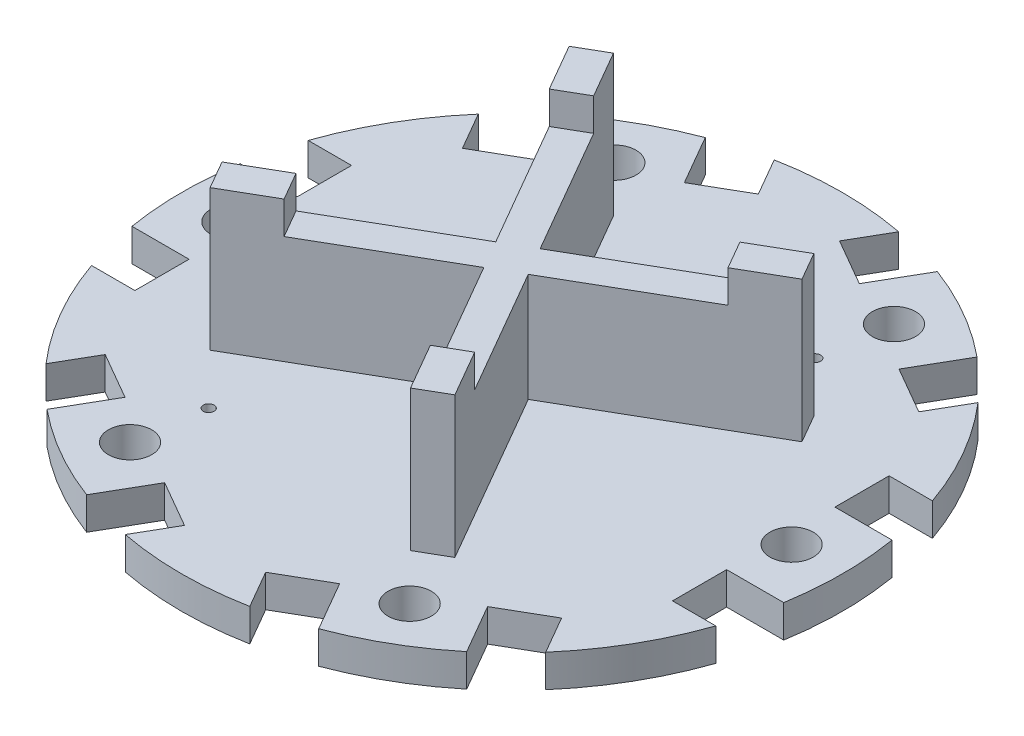
from build123d import *

# Parameters (mm, degrees)
CROQUIS1_R              = 30.5
SALIENTE_EXTRUIR1_DEPTH = 3
CORTAR_EXTRUIR3_START   = -4
CORTAR_EXTRUIR3_DEPTH   = 4
CROQUIS7_R              = 2
CORTAR_EXTRUIR4_DEPTH   = 10
CROQUIS8_R              = 0.5
CORTAR_EXTRUIR5_DEPTH   = 3
SALIENTE_EXTRUIR2_DEPTH = 10
SALIENTE_EXTRUIR3_DEPTH = 3


with BuildPart() as part:
    # Croquis1 → Saliente-Extruir1 (new body)
    with BuildSketch(Plane(origin=(0, 0, 0), x_dir=(1, 0, 0), z_dir=(0, 1, 0))):
        Circle(CROQUIS1_R)
    extrude(amount=SALIENTE_EXTRUIR1_DEPTH)

    # Croquis5 → Cortar-Extruir3 (cut)
    with BuildSketch(Plane(origin=(0, 3, 0), x_dir=(1, 0, 0), z_dir=(0, 1, 0)).offset(CORTAR_EXTRUIR3_START)):
        with BuildLine():
            Line((30.087372767, -5), (24.814059068, -5))
            Line((24.814059068, -5), (24.814059068, -10))
            Line((24.814059068, -10), (28.814059068, -10))
            ThreePointArc((28.814059068, -10), (29.556634924, -7.526973624), (30.087372767, -5))
        make_face()
        with BuildLine():
            ThreePointArc((19.373813402, -23.556429149), (21.296867835, -21.833309883), (23.067283572, -19.953707139))
            Line((23.067283572, -19.953707139), (21.067283572, -16.489605524))
            Line((21.067283572, -16.489605524), (16.737156553, -18.989605524))
            Line((16.737156553, -18.989605524), (19.373813402, -23.556429149))
        make_face()
        with BuildLine():
            Line((24.814059068, 5), (30.087372767, 5))
            ThreePointArc((30.087372767, 5), (29.556634924, 7.526973624), (28.814059068, 10))
            Line((28.814059068, 10), (24.814059068, 10))
            Line((24.814059068, 10), (24.814059068, 5))
        make_face()
        with BuildLine():
            ThreePointArc((5.746775496, -29.953707139), (8.25976709, -29.360283507), (10.713559364, -28.556429149))
            Line((10.713559364, -28.556429149), (8.076902515, -23.989605524))
            Line((8.076902515, -23.989605524), (3.746775496, -26.489605524))
            Line((3.746775496, -26.489605524), (5.746775496, -29.953707139))
        make_face()
        with BuildLine():
            Line((21.067283572, 16.489605524), (23.067283572, 19.953707139))
            ThreePointArc((23.067283572, 19.953707139), (21.296867835, 21.833309883), (19.373813402, 23.556429149))
            Line((19.373813402, 23.556429149), (16.737156553, 18.989605524))
            Line((16.737156553, 18.989605524), (21.067283572, 16.489605524))
        make_face()
        with BuildLine():
            ThreePointArc((-10.713559364, -28.556429149), (-8.25976709, -29.360283507), (-5.746775496, -29.953707139))
            Line((-5.746775496, -29.953707139), (-3.746775496, -26.489605524))
            Line((-3.746775496, -26.489605524), (-8.076902515, -23.989605524))
            Line((-8.076902515, -23.989605524), (-10.713559364, -28.556429149))
        make_face()
        with BuildLine():
            Line((8.076902515, 23.989605524), (10.713559364, 28.556429149))
            ThreePointArc((10.713559364, 28.556429149), (8.25976709, 29.360283507), (5.746775496, 29.953707139))
            Line((5.746775496, 29.953707139), (3.746775496, 26.489605524))
            Line((3.746775496, 26.489605524), (8.076902515, 23.989605524))
        make_face()
        with BuildLine():
            ThreePointArc((-23.067283572, -19.953707139), (-21.296867835, -21.833309883), (-19.373813402, -23.556429149))
            Line((-19.373813402, -23.556429149), (-16.737156553, -18.989605524))
            Line((-16.737156553, -18.989605524), (-21.067283572, -16.489605524))
            Line((-21.067283572, -16.489605524), (-23.067283572, -19.953707139))
        make_face()
        with BuildLine():
            Line((-3.746775496, 26.489605524), (-5.746775496, 29.953707139))
            ThreePointArc((-5.746775496, 29.953707139), (-8.25976709, 29.360283507), (-10.713559364, 28.556429149))
            Line((-10.713559364, 28.556429149), (-8.076902515, 23.989605524))
            Line((-8.076902515, 23.989605524), (-3.746775496, 26.489605524))
        make_face()
        with BuildLine():
            ThreePointArc((-30.087372767, -5), (-29.556634924, -7.526973624), (-28.814059068, -10))
            Line((-28.814059068, -10), (-24.814059068, -10))
            Line((-24.814059068, -10), (-24.814059068, -5))
            Line((-24.814059068, -5), (-30.087372767, -5))
        make_face()
        with BuildLine():
            Line((-16.737156553, 18.989605524), (-19.373813402, 23.556429149))
            ThreePointArc((-19.373813402, 23.556429149), (-21.296867835, 21.833309883), (-23.067283572, 19.953707139))
            Line((-23.067283572, 19.953707139), (-21.067283572, 16.489605524))
            Line((-21.067283572, 16.489605524), (-16.737156553, 18.989605524))
        make_face()
        with BuildLine():
            ThreePointArc((-28.814059068, 10), (-29.556634924, 7.526973624), (-30.087372767, 5))
            Line((-30.087372767, 5), (-24.814059068, 5))
            Line((-24.814059068, 5), (-24.814059068, 10))
            Line((-24.814059068, 10), (-28.814059068, 10))
        make_face()
    extrude(amount=CORTAR_EXTRUIR3_DEPTH, mode=Mode.SUBTRACT)

    # Croquis7 → Cortar-Extruir4 (cut)
    with BuildSketch(Plane(origin=(0, 3, 0), x_dir=(1, 0, 0), z_dir=(0, 1, 0))):
        with Locations((25.81405907, 0)):
            Circle(CROQUIS7_R)
        with Locations((12.907029535, 22.355630929)):
            Circle(CROQUIS7_R)
        with Locations((12.907029535, -22.355630929)):
            Circle(CROQUIS7_R)
        with Locations((-12.907029535, 22.355630929)):
            Circle(CROQUIS7_R)
        with Locations((-12.907029535, -22.355630929)):
            Circle(CROQUIS7_R)
        with Locations((-25.81405907, 0)):
            Circle(CROQUIS7_R)
    extrude(amount=-CORTAR_EXTRUIR4_DEPTH, mode=Mode.SUBTRACT)

    # Croquis8 → Cortar-Extruir5 (cut)
    with BuildSketch(Plane(origin=(0, 3, 0), x_dir=(1, 0, 0), z_dir=(0, 1, 0))):
        with Locations((12, 16)):
            Circle(CROQUIS8_R)
        with Locations((-12, -16)):
            Circle(CROQUIS8_R)
    extrude(amount=-CORTAR_EXTRUIR5_DEPTH, mode=Mode.SUBTRACT)

    # Croquis9 → Saliente-Extruir2 (add)
    with BuildSketch(Plane(origin=(0, 3, 0), x_dir=(1, 0, 0), z_dir=(0, 1, 0))):
        Polygon((16.570508076, 11.299038106), (0.549038106, 2.049038106), (-8.700961894, 18.070508076), (-11.299038106, 16.570508076), (-2.049038106, 0.549038106), (-18.070508076, -8.700961894), (-16.570508076, -11.299038106), (-0.549038106, -2.049038106), (8.700961894, -18.070508076), (11.299038106, -16.570508076), (2.049038106, -0.549038106), (18.070508076, 8.700961894), align=None)
    extrude(amount=SALIENTE_EXTRUIR2_DEPTH)

    # Croquis10 → Saliente-Extruir3 (add)
    with BuildSketch(Plane(origin=(0, 13, 0), x_dir=(1, 0, 0), z_dir=(0, 1, 0))):
        Polygon((-8.700961894, 18.070508076), (-11.299038106, 16.570508076), (-8.799038106, 12.240381057), (-6.200961894, 13.740381057), align=None)
        Polygon((-12.240381057, -8.799038106), (-13.740381057, -6.200961894), (-18.070508076, -8.700961894), (-16.570508076, -11.299038106), align=None)
        Polygon((8.700961894, -18.070508076), (11.299038106, -16.570508076), (8.799038106, -12.240381057), (6.200961894, -13.740381057), align=None)
        Polygon((12.240381057, 8.799038106), (13.740381057, 6.200961894), (18.070508076, 8.700961894), (16.570508076, 11.299038106), align=None)
    extrude(amount=SALIENTE_EXTRUIR3_DEPTH)


solid = part.part
